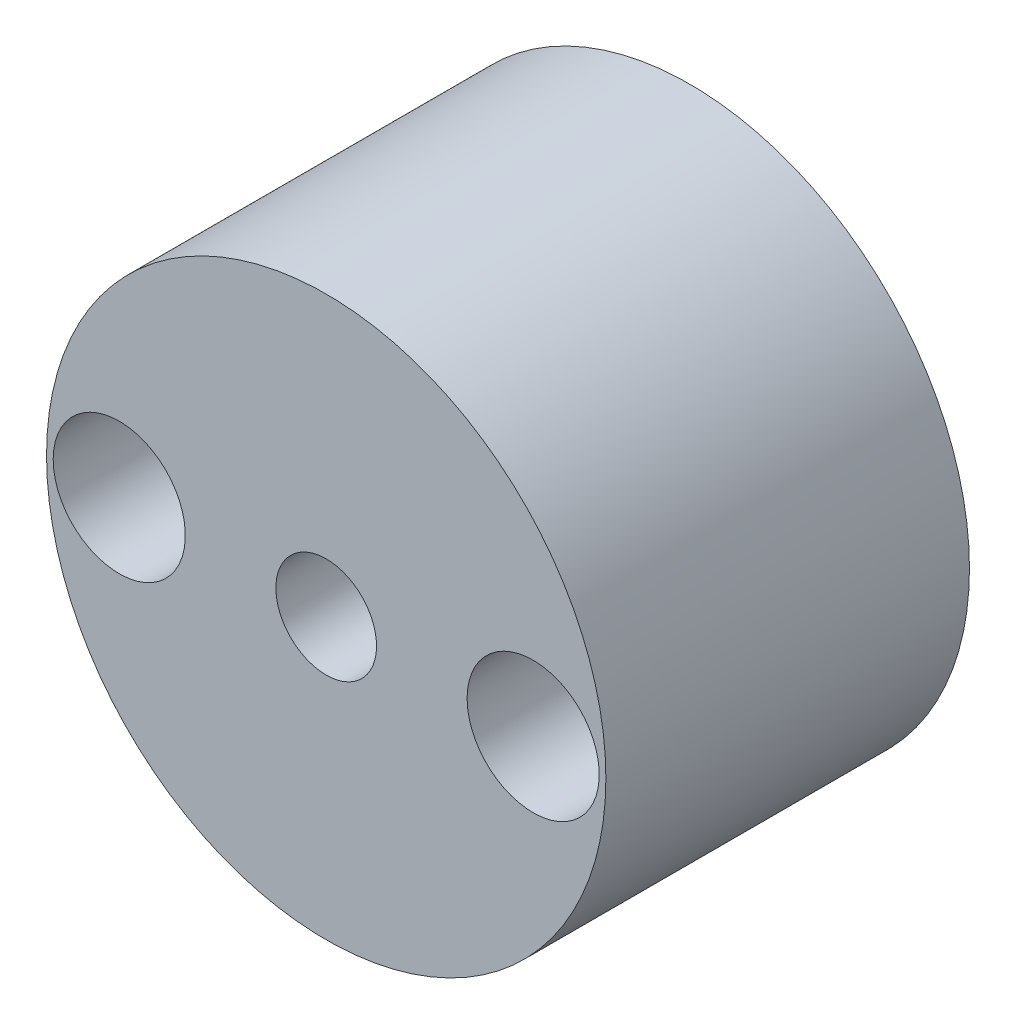
from build123d import *

# Parameters (mm, degrees)
SKETCH1_R             = 6.35
BOSS_EXTRUDE1_DEPTH   = 5.08
SKETCH2_R             = 6.35
SKETCH2_R_2           = 1.143
BOSS_EXTRUDE2_DEPTH   = 3.175
F_3_0MM_DOWEL_HOLE1_D = 3


with BuildPart() as part:
    # Sketch1 → Boss-Extrude1 (new body)
    with BuildSketch(Plane.XY):
        Circle(SKETCH1_R)
        with BuildLine():
            Line((-2.413, -2.54), (-2.413, 2.54))
            ThreePointArc((-2.413, 2.54), (0, 3.503451013), (2.413, 2.54))
            Line((2.413, 2.54), (2.413, -2.54))
            ThreePointArc((2.413, -2.54), (0, -3.503451013), (-2.413, -2.54))
        make_face(mode=Mode.SUBTRACT)
    extrude(amount=BOSS_EXTRUDE1_DEPTH)

    # Sketch2 → Boss-Extrude2 (add)
    with BuildSketch(Plane.XY.offset(5.08)):
        Circle(SKETCH2_R)
        Circle(SKETCH2_R_2, mode=Mode.SUBTRACT)
    extrude(amount=BOSS_EXTRUDE2_DEPTH)

    # Ø3.0mm Dowel Hole1 (through all)
    with Locations(Plane(origin=(0, 0, 0), x_dir=(-1, 0, 0), z_dir=(0, 0, -1))):
        with Locations((-4.699, 0), (4.699, 0)):
            Hole(F_3_0MM_DOWEL_HOLE1_D / 2)


solid = part.part
